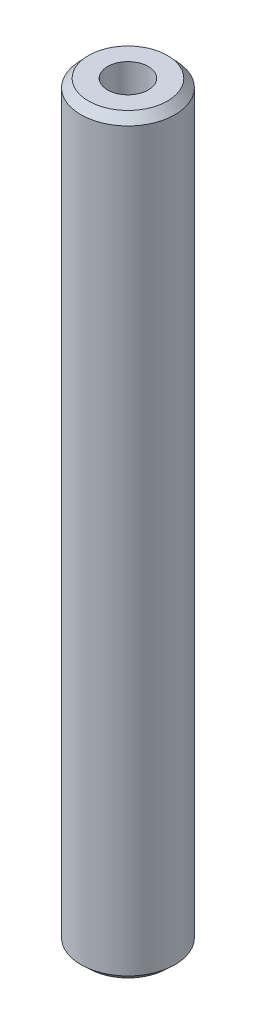
from build123d import *
from OCP.BRepFilletAPI import BRepFilletAPI_MakeChamfer

# Parameters (mm, degrees)
SKETCH1_R           = 10
BOSS_EXTRUDE1_DEPTH = 159.96838126
SKETCH2_R           = 4.333683712
CUT_EXTRUDE1_DEPTH  = 161.592288118
CHAMFER1_SIZE       = 1.728347955
CHAMFER1_SIZE2      = 1.596817331


with BuildPart() as part:
    # Sketch1 → Boss-Extrude1 (new body)
    with BuildSketch(Plane(origin=(0, 0, 0), x_dir=(1, 0, 0), z_dir=(0, 1, 0))):
        Circle(SKETCH1_R)
    extrude(amount=BOSS_EXTRUDE1_DEPTH)

    # Sketch2 → Cut-Extrude1 (cut, through all)
    with BuildSketch(Plane(origin=(0, 0, 0), x_dir=(1, 0, 0), z_dir=(0, 1, 0))):
        Circle(SKETCH2_R)
    extrude(amount=CUT_EXTRUDE1_DEPTH, mode=Mode.SUBTRACT)

    # Chamfer1: one chamfer whose edges measure the first distance from different faces: ONE call of the kernel's chamfer builder (chamfer() names one face for all edges)
    chamfer1_edges_1 = [part.edges().sort_by_distance(p)[0] for p in [
        (-10, 159.96838126, 0),
    ]]
    chamfer1_side_1 = [part.faces().sort_by_distance(p)[0] for p in [
        (-10, 79.98419063, 0),
    ]]
    chamfer1_edges_2 = [part.edges().sort_by_distance(p)[0] for p in [
        (-10, 0, 0),
    ]]
    chamfer1_side_2 = [part.faces().sort_by_distance(p)[0] for p in [
        (-9.717157288, 0, 0),
    ]]
    chamfer1 = BRepFilletAPI_MakeChamfer(part.part.solid().wrapped)
    for e in chamfer1_edges_1:
        chamfer1.Add(CHAMFER1_SIZE, CHAMFER1_SIZE2, e.wrapped, chamfer1_side_1[0].wrapped)  # the first distance lies on this face
    for e in chamfer1_edges_2:
        chamfer1.Add(CHAMFER1_SIZE, CHAMFER1_SIZE2, e.wrapped, chamfer1_side_2[0].wrapped)  # the first distance lies on this face
    add(Compound.cast(chamfer1.Shape()), mode=Mode.REPLACE)


solid = part.part
